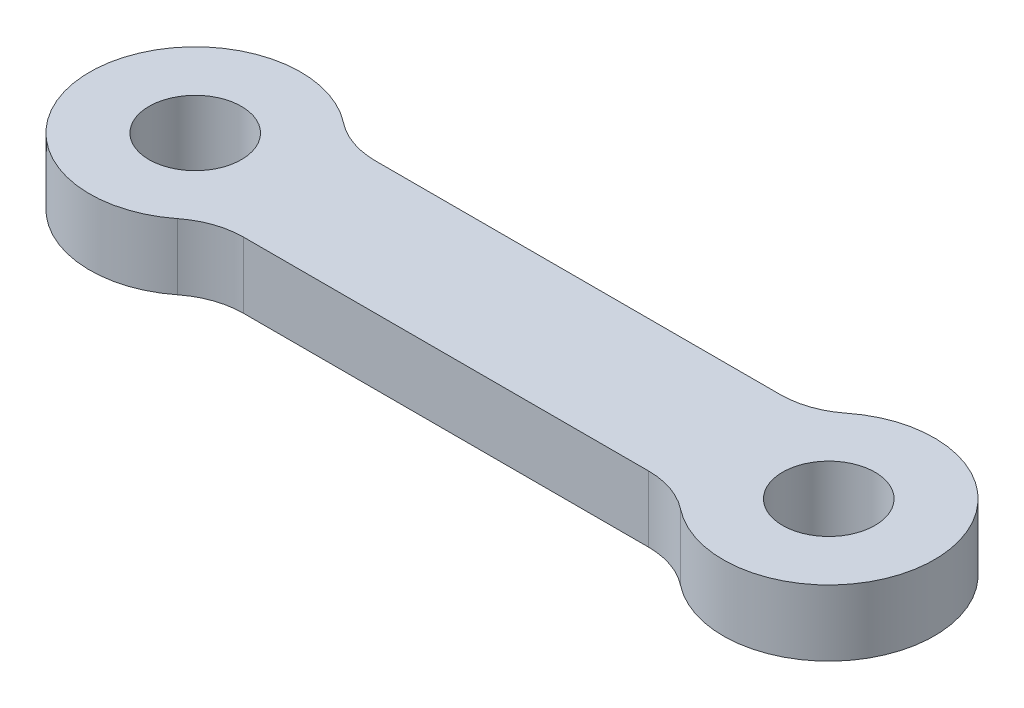
from build123d import *

# Parameters (mm, degrees)
SKETCH1_R           = 1.75
BOSS_EXTRUDE1_DEPTH = 2.5
FILLET1_R           = 3


with BuildPart() as part:
    # Sketch1 → Boss-Extrude1 (new body)
    with BuildSketch(Plane(origin=(0, 0, 0), x_dir=(1, 0, 0), z_dir=(0, 1, 0))):
        with BuildLine():
            ThreePointArc((3.122498999, 2.5), (-4, 0), (3.122498999, -2.5))
            Line((3.122498999, -2.5), (20.877501001, -2.5))
            ThreePointArc((20.877501001, -2.5), (28, 0), (20.877501001, 2.5))
            Line((20.877501001, 2.5), (3.122498999, 2.5))
        make_face()
        Circle(SKETCH1_R, mode=Mode.SUBTRACT)
        with Locations((24, 0)):
            Circle(SKETCH1_R, mode=Mode.SUBTRACT)
    extrude(amount=BOSS_EXTRUDE1_DEPTH)

    # Fillet1
    fillet1_edges = [part.edges().sort_by_distance(p)[0] for p in [
        (3.122498999, 1.25, 2.5),
        (20.877501001, 1.25, 2.5),
        (20.877501001, 1.25, -2.5),
        (3.122498999, 1.25, -2.5),
    ]]
    fillet(fillet1_edges, radius=FILLET1_R)


solid = part.part
